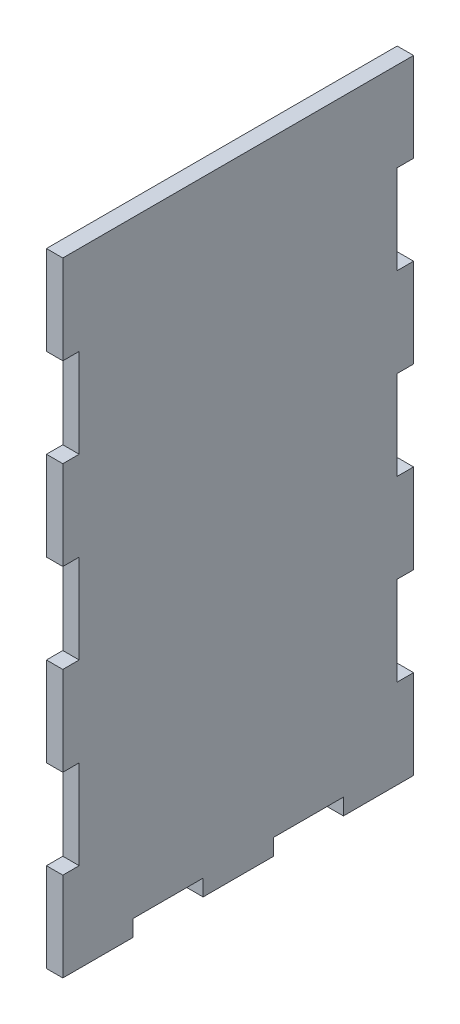
from build123d import *

# Parameters (mm, degrees)
SKETCH1_W           = 114.3
SKETCH1_H           = 203.2
BOSS_EXTRUDE1_DEPTH = 5.334
SKETCH3_W           = 5.334
SKETCH3_H           = 29.028571428
CUT_EXTRUDE4_DEPTH  = 117.692476433
SKETCH5_W           = 22.86
SKETCH5_H           = 5.334
CUT_EXTRUDE5_DEPTH  = 117.692476433


with BuildPart() as part:
    # Sketch1 → Boss-Extrude1 (new body)
    with BuildSketch(Plane(origin=(0, 0, 0), x_dir=(0, 0, -1), z_dir=(1, 0, 0))):
        Rectangle(SKETCH1_W, SKETCH1_H)
    extrude(amount=BOSS_EXTRUDE1_DEPTH)

    # Sketch3 → Cut-Extrude4 (cut, through all)
    with BuildSketch(Plane(origin=(5.334, 0, 0), x_dir=(0, 0, -1), z_dir=(1, 0, 0))):
        with Locations((-54.483, -58.057142857)):
            Rectangle(SKETCH3_W, SKETCH3_H)
        with Locations((-54.483, 0)):
            Rectangle(SKETCH3_W, SKETCH3_H)
        with Locations((-54.483, 58.057142857)):
            Rectangle(SKETCH3_W, SKETCH3_H)
        with Locations((54.483, 58.057142857)):
            Rectangle(SKETCH3_W, SKETCH3_H)
        with Locations((54.483, 0)):
            Rectangle(SKETCH3_W, SKETCH3_H)
        with Locations((54.483, -58.057142857)):
            Rectangle(SKETCH3_W, SKETCH3_H)
    extrude(amount=-CUT_EXTRUDE4_DEPTH, mode=Mode.SUBTRACT)

    # Sketch5 → Cut-Extrude5 (cut, through all)
    with BuildSketch(Plane(origin=(5.334, 0, 0), x_dir=(0, 0, -1), z_dir=(1, 0, 0))):
        with Locations((-22.86, -98.933)):
            Rectangle(SKETCH5_W, SKETCH5_H)
        with Locations((22.86, -98.933)):
            Rectangle(SKETCH5_W, SKETCH5_H)
    extrude(amount=-CUT_EXTRUDE5_DEPTH, mode=Mode.SUBTRACT)


solid = part.part
